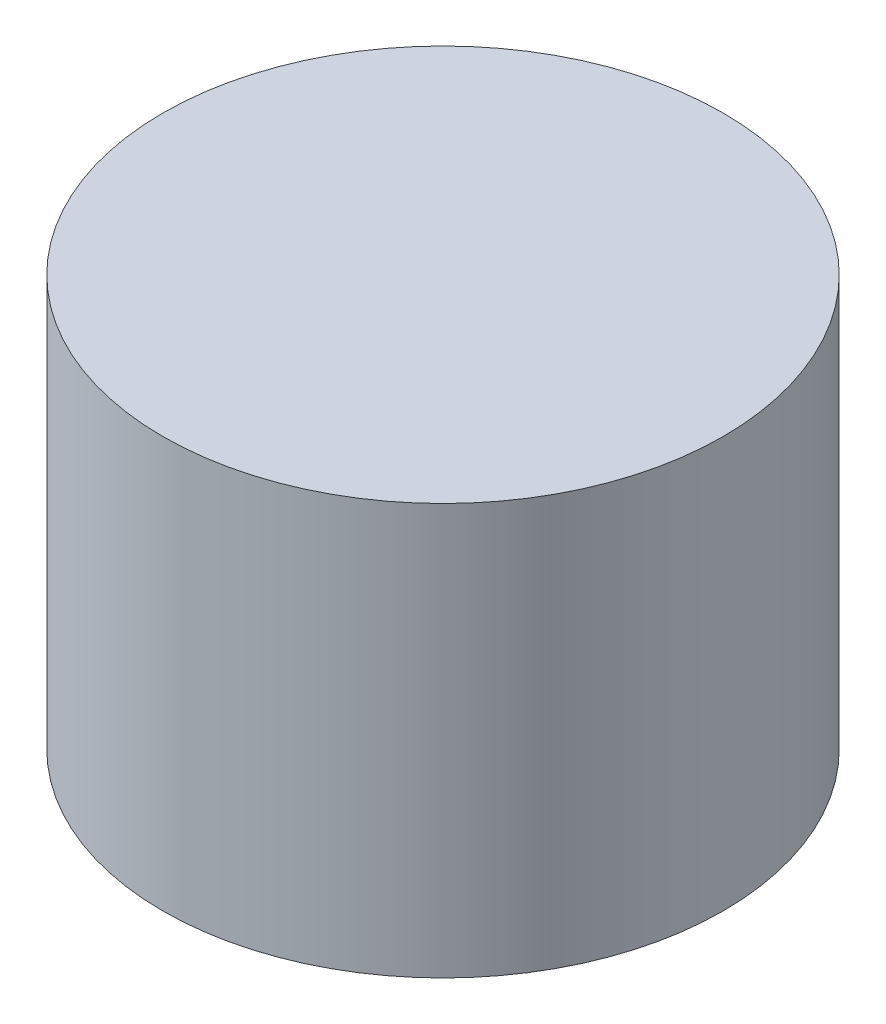
from build123d import *

# Parameters (mm, degrees)
SKETCH1_R           = 7.5
BOSS_EXTRUDE1_DEPTH = 13
SKETCH2_R           = 6.5
CUT_EXTRUDE1_DEPTH  = 7
SKETCH3_W           = 8
SKETCH3_H           = 5
CUT_EXTRUDE2_DEPTH  = 5
SKETCH5_R           = 5
CUT_EXTRUDE5_DEPTH  = 5
SKETCH7_R           = 0.9
BOSS_EXTRUDE4_DEPTH = 14
SKETCH10_R          = 2
BOSS_EXTRUDE5_DEPTH = 5
BOSS_EXTRUDE6_START = -5
SKETCH11_R          = 2
BOSS_EXTRUDE6_DEPTH = 5
SKETCH13_R          = 7.5
CUT_EXTRUDE6_DEPTH  = 2
CHAMFER1_SIZE       = 1


with BuildPart() as part:
    # Sketch1 → Boss-Extrude1 (new body)
    with BuildSketch(Plane(origin=(0, 0, 0), x_dir=(1, 0, 0), z_dir=(0, 1, 0))):
        with Locations(Location((0, 0, 0), (0, 0, 90))):
            Circle(SKETCH1_R)
    extrude(amount=BOSS_EXTRUDE1_DEPTH)

    # Sketch2 → Cut-Extrude1 (cut)
    with BuildSketch(Plane.XZ):
        with Locations(Location((0, 0, 0), (0, 0, 270))):
            Circle(SKETCH2_R)
    extrude(amount=-CUT_EXTRUDE1_DEPTH, mode=Mode.SUBTRACT)

    # Sketch3 → Cut-Extrude2 (cut)
    with BuildSketch(Plane.XZ.offset(-7)):
        Rectangle(SKETCH3_W, SKETCH3_H)
    extrude(amount=-CUT_EXTRUDE2_DEPTH, mode=Mode.SUBTRACT)

    # Sketch5 → Cut-Extrude5 (cut)
    with BuildSketch(Plane.XZ.offset(-7)):
        with Locations(Location((0, 0, 0), (0, 0, 270))):
            Circle(SKETCH5_R)
    extrude(amount=-CUT_EXTRUDE5_DEPTH, mode=Mode.SUBTRACT)

    # Sketch7 → Boss-Extrude4 (add)
    with BuildSketch(Plane.XY.offset(7)):
        with Locations((0, 8)):
            Circle(SKETCH7_R)
    extrude(amount=-BOSS_EXTRUDE4_DEPTH)

    # Sketch10 → Boss-Extrude5 (add)
    with BuildSketch(Plane.XY.offset(2)):
        with Locations(Location((0, 8, 0), (0, 0, 209.999999411))):
            Circle(SKETCH10_R)
    extrude(amount=BOSS_EXTRUDE5_DEPTH)

    # Sketch11 → Boss-Extrude6 (add)
    with BuildSketch(Plane.XY.offset(-2).offset(BOSS_EXTRUDE6_START)):
        with Locations(Location((0, 8, 0), (0, 0, 209.999999411))):
            Circle(SKETCH11_R)
    extrude(amount=BOSS_EXTRUDE6_DEPTH)

    # Sketch13 → Cut-Extrude6 (cut)
    with BuildSketch(Plane.XZ):
        with Locations(Location((0, 0, 0), (0, 0, 270))):
            Circle(SKETCH13_R)
    extrude(amount=-CUT_EXTRUDE6_DEPTH, mode=Mode.SUBTRACT)

    # Chamfer1
    chamfer1_edges = [part.edges().sort_by_distance(p)[0] for p in [
        (0, 2, 6.5),
    ]]
    chamfer(chamfer1_edges, length=CHAMFER1_SIZE - 0.0001)  # a hair under: the kernel refuses the full size


solid = part.part
